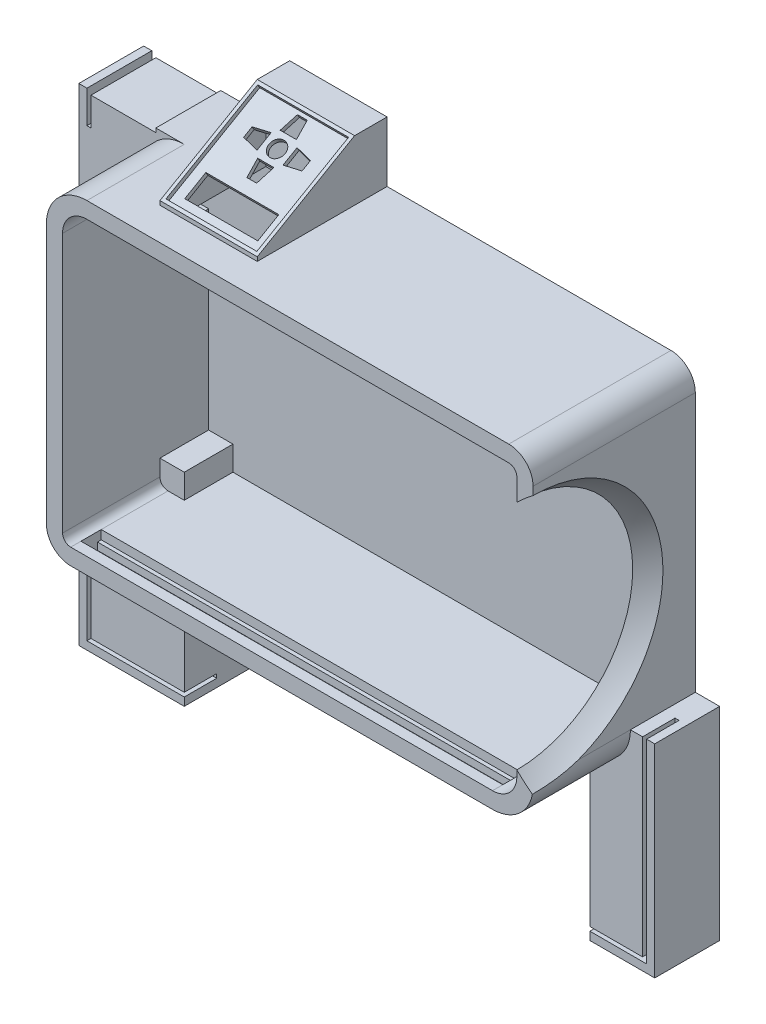
from build123d import *

# Parameters (mm, degrees)
SKETCH1_W           = 381
SKETCH1_H           = 254
BOSS_EXTRUDE1_DEPTH = 127
FILLET5_R           = 19.05
FILLET4_R           = 31.75
CUT_EXTRUDE1_DEPTH  = 114.3
CUT_EXTRUDE2_REACH  = 343.958
SKETCH5_W           = 330.2
SKETCH5_H           = 10.5
BOSS_EXTRUDE2_START = -50.8
BOSS_EXTRUDE2_DEPTH = 50.8
CUT_EXTRUDE3_DEPTH  = 25.4
BOSS_EXTRUDE3_DEPTH = 76.2
SKETCH10_W          = 71.12
SKETCH10_H          = 82.908181025
CUT_EXTRUDE4_DEPTH  = 12.7
CUT_EXTRUDE5_REACH  = 460.257
SKETCH11_W          = 71.12
SKETCH11_H          = 71.800590948
SKETCH12_W          = 71.12
SKETCH12_H          = 82.908181025
SKETCH12_R          = 6.35
SKETCH12_W_2        = 57.15
SKETCH12_H_2        = 19.05
BOSS_EXTRUDE4_DEPTH = 3.175
SKETCH13_W          = 330.2
SKETCH13_H          = 15.875
CUT_EXTRUDE6_DEPTH  = 7
SKETCH14_W          = 34.1
SKETCH14_H          = 66.2
CUT_EXTRUDE7_DEPTH  = 57.15
CUT_EXTRUDE8_START  = 34.1
CUT_EXTRUDE8_DEPTH  = 34.1
SKETCH16_W          = 11
SKETCH16_H          = 20
BOSS_EXTRUDE5_DEPTH = 5
SKETCH17_R          = 2
CUT_EXTRUDE9_DEPTH  = 367.998882862


# Read off the part's stored shape, not the designer's step: Boss-Extrude2
with BuildPart() as part:
    # Sketch1 → Boss-Extrude1 (new body)
    with BuildSketch(Plane.XY):
        Rectangle(SKETCH1_W, SKETCH1_H)
    extrude(amount=-BOSS_EXTRUDE1_DEPTH)

    # Fillet5
    fillet5_edges = [part.edges().sort_by_distance(p)[0] for p in [
        (-190.5, -127, -63.5),
        (190.5, 127, -63.5),
    ]]
    fillet(fillet5_edges, radius=FILLET5_R)

    # Fillet4
    fillet4_edges = [part.edges().sort_by_distance(p)[0] for p in [
        (190.5, -127, -63.5),
        (-190.5, 127, -63.5),
    ]]
    fillet(fillet4_edges, radius=FILLET4_R)

    # Sketch3 → Cut-Extrude1 (cut)
    with BuildSketch(Plane(origin=(0, 0, 0), x_dir=(-1, 0, 0), z_dir=(0, 0, -1))):
        with BuildLine():
            Line((-158.75, -114.3), (171.45, -114.3))
            ThreePointArc((171.45, -114.3), (175.940128061, -112.440128061), (177.8, -107.95))
            Line((177.8, -107.95), (177.8, 95.25))
            ThreePointArc((177.8, 95.25), (172.220384182, 108.720384182), (158.75, 114.3))
            Line((158.75, 114.3), (-171.45, 114.3))
            ThreePointArc((-171.45, 114.3), (-175.940128061, 112.440128061), (-177.8, 107.95))
            Line((-177.8, 107.95), (-177.8, -95.25))
            ThreePointArc((-177.8, -95.25), (-172.220384182, -108.720384182), (-158.75, -114.3))
        make_face()
    extrude(amount=CUT_EXTRUDE1_DEPTH, mode=Mode.SUBTRACT)

    # Sketch5 → Cut-Extrude2 (cut, up to next)
    with BuildSketch(Plane.XZ.offset(127), mode=Mode.PRIVATE) as cut_extrude2_sk1:
        with Locations((-6.35, -15.705)):
            Rectangle(SKETCH5_W, SKETCH5_H)
    cut_extrude2_tool1 = extrude(cut_extrude2_sk1.sketch, amount=-CUT_EXTRUDE2_REACH, mode=Mode.PRIVATE) & part.part
    add(cut_extrude2_tool1.solids().sort_by_distance((-6.35, -127, -15.705))[0], mode=Mode.SUBTRACT)

    # Sketch6 → Cut-Revolve1 (revolve, cut)
    with BuildSketch(Plane(origin=(0, 0, 0), x_dir=(1, 0, 0), z_dir=(0, 1, 0))):
        with BuildLine():
            Line((139.7, 0), (266.7, 0))
            Line((266.7, 0), (266.7, 127))
            ThreePointArc((266.7, 127), (176.897438789, 89.802561211), (139.7, 0))
        make_face()
    revolve(axis=Axis((266.7, 0, 0), (0, 0, -1)), mode=Mode.SUBTRACT)

    # Boss-Extrude2 outline → Boss-Extrude2 (add)
    with BuildSketch(Plane(origin=(0, 0, -127), x_dir=(-1, 0, 0), z_dir=(0, 0, -1)).offset(BOSS_EXTRUDE2_START)):
        with BuildLine():
            Line((-158.75, -254), (-158.75, -127))
            ThreePointArc((-158.75, -127), (-181.200640303, -117.700640303), (-190.5, -95.25))
            Line((-190.5, -95.25), (-209.55, -95.25))
            Line((-209.55, -95.25), (-209.55, -254))
            Line((-209.55, -254), (-158.75, -254))
        make_face()
        with BuildLine():
            ThreePointArc((-177.8, -95.25), (-172.220384182, -108.720384182), (-158.75, -114.3))
            Line((-158.75, -114.3), (-158.75, -95.25))
            Line((-158.75, -95.25), (-177.8, -95.25))
        make_face()
        with BuildLine():
            Line((158.75, -95.25), (158.75, -114.3))
            Line((158.75, -114.3), (171.45, -114.3))
            ThreePointArc((171.45, -114.3), (175.940128061, -112.440128061), (177.8, -107.95))
            Line((177.8, -107.95), (177.8, -95.25))
            Line((177.8, -95.25), (158.75, -95.25))
        make_face()
        with BuildLine():
            Line((241.3, -95.25), (190.5, -95.25))
            Line((190.5, -95.25), (190.5, -107.95))
            ThreePointArc((190.5, -107.95), (184.920384182, -121.420384182), (171.45, -127))
            Line((171.45, -127), (158.75, -127))
            Line((158.75, -127), (158.75, -254))
            Line((158.75, -254), (241.3, -254))
            Line((241.3, -254), (241.3, -95.25))
        make_face()
        with BuildLine():
            Line((241.3, 127), (234.95, 127))
            Line((234.95, 127), (234.95, 101.6))
            Line((234.95, 101.6), (231.775, 101.6))
            Line((231.775, 101.6), (231.775, 123.825))
            Line((231.775, 123.825), (180.975, 123.825))
            Line((180.975, 123.825), (180.975, 127))
            Line((180.975, 127), (158.75, 127))
            ThreePointArc((158.75, 127), (181.200640303, 117.700640303), (190.5, 95.25))
            Line((190.5, 95.25), (190.5, 50.8))
            Line((190.5, 50.8), (241.3, 50.8))
            Line((241.3, 50.8), (241.3, 127))
        make_face()
    extrude(amount=BOSS_EXTRUDE2_DEPTH)

    # Sketch8 → Cut-Extrude3 (cut)
    with BuildSketch(Plane.XY.offset(-76.2)):
        Polygon((-234.95, -95.25), (-234.95, -247.65), (-158.75, -247.65), (-158.75, -244.475), (-231.775, -244.475), (-231.775, -95.25), align=None)
        Polygon((158.75, -247.65), (203.2, -247.65), (203.2, -95.25), (200.025, -95.25), (200.025, -244.475), (158.75, -244.475), align=None)
    extrude(amount=-CUT_EXTRUDE3_DEPTH, mode=Mode.SUBTRACT)

    # Sketch9 → Boss-Extrude3 (add)
    with BuildSketch(Plane(origin=(-127, 0, 0), x_dir=(0, 0, -1), z_dir=(1, 0, 0))):
        Polygon((25.4, 127), (25.4, 130.175), (101.6, 174.169090512), (127, 174.169090512), (127, 127), align=None)
    extrude(amount=BOSS_EXTRUDE3_DEPTH)

    # Sketch10 → Cut-Extrude4 (cut)
    with BuildSketch(Plane(origin=(0, 86.632727372, 50.017428469), x_dir=(1, 0, 0), z_dir=(0, 0.866025403784436, 0.5000000000000047))):
        with Locations((-88.9, 131.078635769)):
            Rectangle(SKETCH10_W, SKETCH10_H)
    extrude(amount=-CUT_EXTRUDE4_DEPTH, mode=Mode.SUBTRACT)

    # Cut-Extrude5: up to this face of the body (flat: up to its plane)
    cut_extrude5_end = Plane(part.part.faces().sort_by_distance((-88.9, 141.173522628, -69.85))[0])
    # Sketch11 → Cut-Extrude5 (cut, up to the picked face)
    with BuildSketch(Plane.XZ.offset(-114.3), mode=Mode.PRIVATE) as cut_extrude5_sk1:
        with Locations((-88.9, -69.85)):
            Rectangle(SKETCH11_W, SKETCH11_H)
    cut_extrude5_tool1 = split(extrude(cut_extrude5_sk1.sketch, amount=-CUT_EXTRUDE5_REACH, mode=Mode.PRIVATE), bisect_by=cut_extrude5_end, keep=Keep.BOTH, mode=Mode.PRIVATE)
    add(cut_extrude5_tool1.solids().sort_by(Axis((-88.9, 114.3, -69.85), (0, 1, 0)))[0], mode=Mode.SUBTRACT)

    # Sketch12 → Boss-Extrude4 (add)
    with BuildSketch(Plane(origin=(0, 83.883096715, 48.429928469), x_dir=(1, 0, 0), z_dir=(0, 0.866025403784436, 0.5000000000000047))):
        with Locations((-88.9, 131.078635769)):
            Rectangle(SKETCH12_W, SKETCH12_H)
        with Locations(Location((-88.9, 147.132726281, 0), (0, 0, 270))):
            Circle(SKETCH12_R, mode=Mode.SUBTRACT)
        Polygon((-82.55, 136.972726281), (-95.25, 136.972726281), (-92.71, 124.272726281), (-85.09, 124.272726281), align=None, mode=Mode.SUBTRACT)
        Polygon((-78.74, 153.482726281), (-66.04, 150.942726281), (-66.04, 143.322726281), (-78.74, 140.782726281), align=None, mode=Mode.SUBTRACT)
        Polygon((-99.06, 140.782726281), (-99.06, 153.482726281), (-111.76, 150.942726281), (-111.76, 143.322726281), align=None, mode=Mode.SUBTRACT)
        Polygon((-95.25, 157.292726281), (-82.55, 157.292726281), (-85.09, 169.992726281), (-92.71, 169.992726281), align=None, mode=Mode.SUBTRACT)
        with Locations((-88.265, 105.499545256)):
            Rectangle(SKETCH12_W_2, SKETCH12_H_2, mode=Mode.SUBTRACT)
    extrude(amount=-BOSS_EXTRUDE4_DEPTH)

    # Sketch13 → Cut-Extrude6 (cut)
    with BuildSketch(Plane(origin=(0, -114.3, 0), x_dir=(1, 0, 0), z_dir=(0, 1, 0))):
        with Locations((-6.35, 15.955)):
            Rectangle(SKETCH13_W, SKETCH13_H)
    extrude(amount=-CUT_EXTRUDE6_DEPTH, mode=Mode.SUBTRACT)

    # Sketch14 → Cut-Extrude7 (cut)
    with BuildSketch(Plane(origin=(-234.95, 0, 0), x_dir=(0, 0, -1), z_dir=(1, 0, 0))):
        with Locations((97.25, 87.9)):
            Rectangle(SKETCH14_W, SKETCH14_H)
    extrude(amount=CUT_EXTRUDE7_DEPTH, mode=Mode.SUBTRACT)

    # Sketch15 → Cut-Extrude8 (cut)
    with BuildSketch(Plane.XY.offset(-114.3).offset(CUT_EXTRUDE8_START)):
        with BuildLine():
            Line((-158.75, 114.3), (-177.8, 114.3))
            Line((-177.8, 114.3), (-177.8, 95.25))
            ThreePointArc((-177.8, 95.25), (-172.220384182, 108.720384182), (-158.75, 114.3))
        make_face()
    extrude(amount=-CUT_EXTRUDE8_DEPTH, mode=Mode.SUBTRACT)

    # Sketch16 → Boss-Extrude5 (add)
    with BuildSketch(Plane.XY.offset(-114.3)):
        with Locations((-226.275, 108)):
            Rectangle(SKETCH16_W, SKETCH16_H)
    extrude(amount=BOSS_EXTRUDE5_DEPTH)

    # Sketch17 → Cut-Extrude9 (cut, through all)
    with BuildSketch(Plane.XY.offset(-109.3)):
        with Locations((-223.675, 112.5)):
            Circle(SKETCH17_R)
        with Locations((-223.675, 103)):
            Circle(SKETCH17_R)
    extrude(amount=-CUT_EXTRUDE9_DEPTH, mode=Mode.SUBTRACT)


solid = part.part
